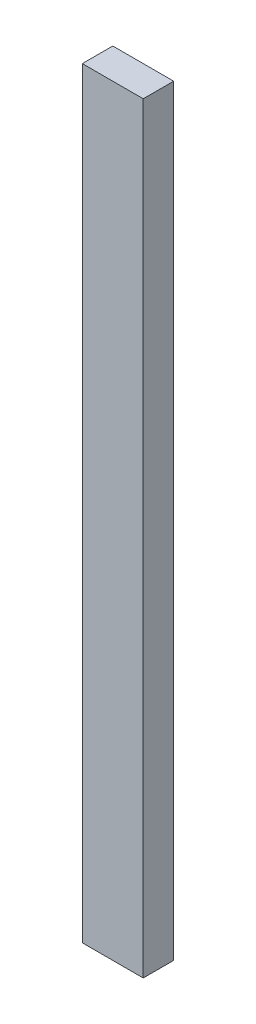
from build123d import *

# Parameters (mm, degrees)
SKETCH_1_W      = 40
SKETCH_1_H      = 20
EXTRUDE_1_DEPTH = 500


with BuildPart() as part:
    # Эскиз1 → Бобышка-Вытянуть1 (new body)
    with BuildSketch(Plane(origin=(0, 0, 0), x_dir=(1, 0, 0), z_dir=(0, 1, 0))):
        with Locations((20, 10)):
            Rectangle(SKETCH_1_W, SKETCH_1_H)
    extrude(amount=EXTRUDE_1_DEPTH)


solid = part.part
